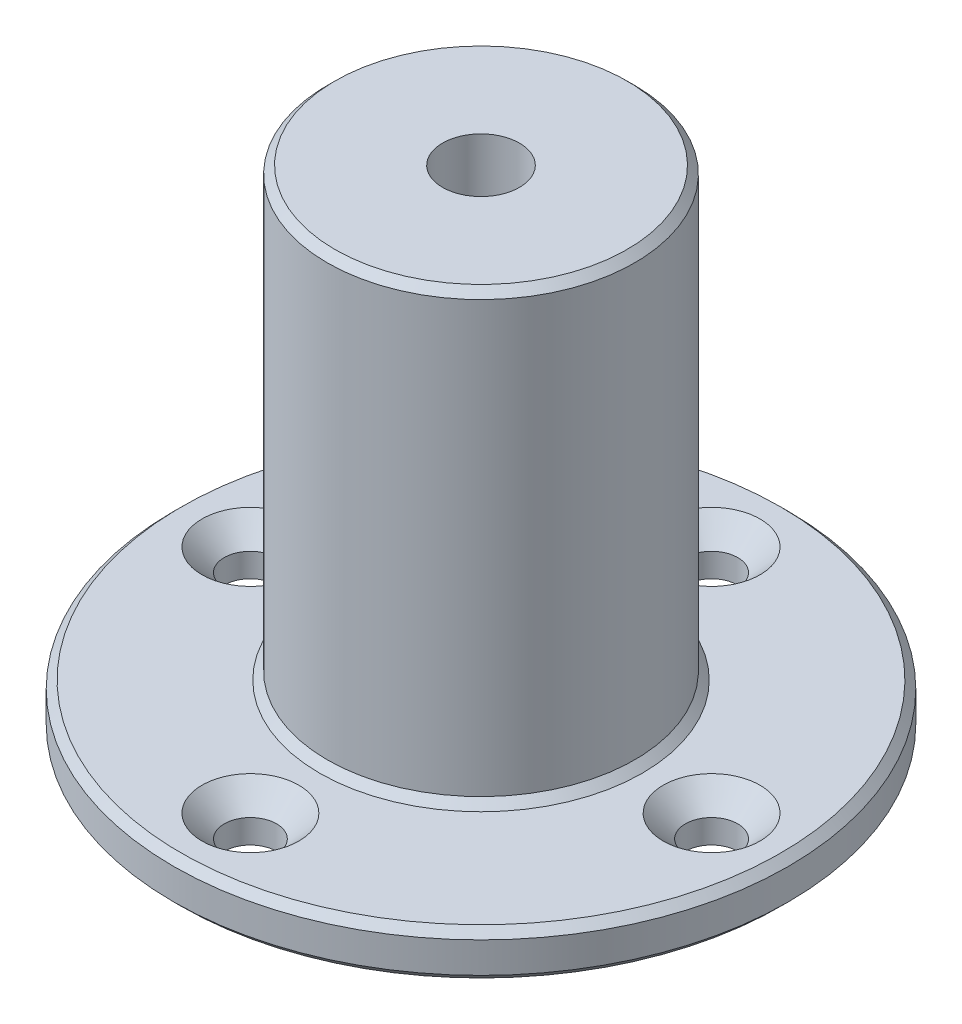
from build123d import *

# Parameters (mm, degrees)
SKETCH1_R             = 10
BOSS_EXTRUDE1_DEPTH   = 32
SKETCH2_R             = 20
BOSS_EXTRUDE2_DEPTH   = 3
CIRPATTERN1_COUNT     = 4
M6_TAPPED_HOLE1_D     = 5
M6_TAPPED_HOLE1_DEPTH = 17
M6_TAPPED_HOLE1_TIP   = 1.502151548
CHAMFER1_SIZE         = 0.5


with BuildPart() as part:
    # Sketch1 → Boss-Extrude1 (new body)
    with BuildSketch(Plane(origin=(0, 0, 0), x_dir=(1, 0, 0), z_dir=(0, 1, 0))):
        Circle(SKETCH1_R)
    extrude(amount=BOSS_EXTRUDE1_DEPTH)

    # Sketch2 → Boss-Extrude2 (add)
    with BuildSketch(Plane.XZ):
        Circle(SKETCH2_R)
    extrude(amount=-BOSS_EXTRUDE2_DEPTH)

    # Sketch3 → CSK for M3 Countersunk Flat Head Screw1 (revolve, cut)
    with BuildSketch(Plane(origin=(0, 3, -15), x_dir=(0, 0, 1), z_dir=(1, 0, 0))):
        Polygon((0, 0), (0, 3), (1.7, 3), (1.7, 1.45), (3.15, 0), align=None)
    csk_for_m3_countersunk_flat_head_screw1 = revolve(axis=Axis((0, 9.35, -15), (0, -1, 0)), mode=Mode.SUBTRACT)

    # CirPattern1: CSK for M3 Countersunk Flat Head Screw1 ×4 about axis
    cirpattern1_axis = Axis((0, 3, 0), (0, -1, 0))
    for i in range(1, CIRPATTERN1_COUNT):
        add(csk_for_m3_countersunk_flat_head_screw1.rotate(cirpattern1_axis, i * 360 / CIRPATTERN1_COUNT), mode=Mode.SUBTRACT)

    # M6 Tapped Hole1
    with Locations(Plane(origin=(0, 32, 0), x_dir=(1, 0, 0), z_dir=(0, 1, 0))):
        with Locations((0, 0)):
            Hole(M6_TAPPED_HOLE1_D / 2, depth=M6_TAPPED_HOLE1_DEPTH)
            with Locations((0, 0, -(M6_TAPPED_HOLE1_DEPTH + M6_TAPPED_HOLE1_TIP / 2))):  # 118° drill point
                Cone(0, M6_TAPPED_HOLE1_D / 2, M6_TAPPED_HOLE1_TIP, mode=Mode.SUBTRACT)

    # Chamfer1
    chamfer1_edges = [part.edges().sort_by_distance(p)[0] for p in [
        (-20, 0, 0),
        (-20, 3, 0),
        (-10, 32, 0),
        (-10, 3, 0),
    ]]
    chamfer(chamfer1_edges, length=CHAMFER1_SIZE)


solid = part.part
